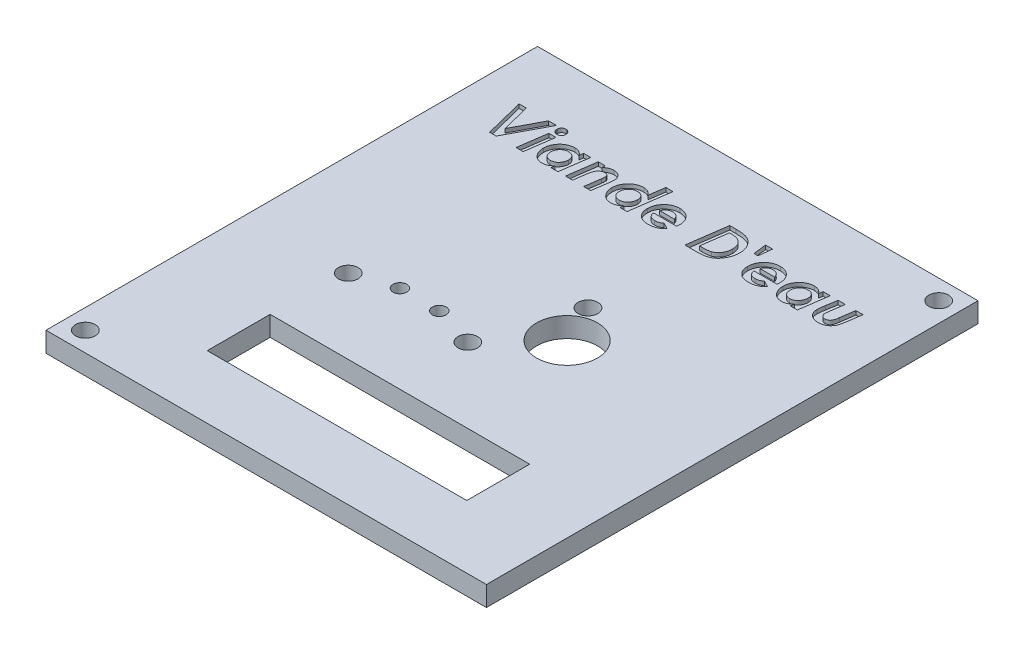
from build123d import *

# Parameters (mm, degrees)
SKETCH1_W           = 112
SKETCH1_H           = 125
BOSS_EXTRUDE1_DEPTH = 5.08
CUT_EXTRUDE1_REACH  = 86.072
SKETCH5_W           = 66
SKETCH5_H           = 16
SKETCH5_R           = 7.75
SKETCH5_R_2         = 2.5
SKETCH5_R_3         = 1.75
SKETCH7_R           = 2.5
CUT_EXTRUDE3_DEPTH  = 4
CUT_EXTRUDE4_DEPTH  = 1


with BuildPart() as part:
    # Sketch1 → Boss-Extrude1 (new body)
    with BuildSketch(Plane(origin=(0, 0, 0), x_dir=(1, 0, 0), z_dir=(0, 1, 0))):
        Rectangle(SKETCH1_W, SKETCH1_H)
    extrude(amount=BOSS_EXTRUDE1_DEPTH)

    # Sketch5 → Cut-Extrude1 (cut, up to next)
    with BuildSketch(Plane(origin=(0, 5.08, 0), x_dir=(1, 0, 0), z_dir=(0, 1, 0)), mode=Mode.PRIVATE) as cut_extrude1_sk1:
        with Locations((2, -38.5)):
            Rectangle(SKETCH5_W, SKETCH5_H)
    cut_extrude1_tool1 = extrude(cut_extrude1_sk1.sketch, amount=-CUT_EXTRUDE1_REACH, mode=Mode.PRIVATE) & part.part
    # Sketch5 → Cut-Extrude1 (cut, up to next)
    with BuildSketch(Plane(origin=(0, 5.08, 0), x_dir=(1, 0, 0), z_dir=(0, 1, 0)), mode=Mode.PRIVATE) as cut_extrude1_sk2:
        with Locations((12.5, 1.5)):
            Circle(SKETCH5_R)
    cut_extrude1_tool2 = extrude(cut_extrude1_sk2.sketch, amount=-CUT_EXTRUDE1_REACH, mode=Mode.PRIVATE) & part.part
    # Sketch5 → Cut-Extrude1 (cut, up to next)
    with BuildSketch(Plane(origin=(0, 5.08, 0), x_dir=(1, 0, 0), z_dir=(0, 1, 0)), mode=Mode.PRIVATE) as cut_extrude1_sk3:
        with Locations((-30.13, -11.51)):
            Circle(SKETCH5_R_2)
    cut_extrude1_tool3 = extrude(cut_extrude1_sk3.sketch, amount=-CUT_EXTRUDE1_REACH, mode=Mode.PRIVATE) & part.part
    # Sketch5 → Cut-Extrude1 (cut, up to next)
    with BuildSketch(Plane(origin=(0, 5.08, 0), x_dir=(1, 0, 0), z_dir=(0, 1, 0)), mode=Mode.PRIVATE) as cut_extrude1_sk4:
        with Locations((-20.25, -8.2495)):
            Circle(SKETCH5_R_3)
    cut_extrude1_tool4 = extrude(cut_extrude1_sk4.sketch, amount=-CUT_EXTRUDE1_REACH, mode=Mode.PRIVATE) & part.part
    # Sketch5 → Cut-Extrude1 (cut, up to next)
    with BuildSketch(Plane(origin=(0, 5.08, 0), x_dir=(1, 0, 0), z_dir=(0, 1, 0)), mode=Mode.PRIVATE) as cut_extrude1_sk5:
        with Locations((-10.25, -8.2495)):
            Circle(SKETCH5_R_3)
    cut_extrude1_tool5 = extrude(cut_extrude1_sk5.sketch, amount=-CUT_EXTRUDE1_REACH, mode=Mode.PRIVATE) & part.part
    # Sketch5 → Cut-Extrude1 (cut, up to next)
    with BuildSketch(Plane(origin=(0, 5.08, 0), x_dir=(1, 0, 0), z_dir=(0, 1, 0)), mode=Mode.PRIVATE) as cut_extrude1_sk6:
        with Locations((0.2695, -11.51)):
            Circle(SKETCH5_R_2)
    cut_extrude1_tool6 = extrude(cut_extrude1_sk6.sketch, amount=-CUT_EXTRUDE1_REACH, mode=Mode.PRIVATE) & part.part
    # Sketch5 → Cut-Extrude1 (cut, up to next)
    with BuildSketch(Plane(origin=(0, 5.08, 0), x_dir=(1, 0, 0), z_dir=(0, 1, 0)), mode=Mode.PRIVATE) as cut_extrude1_sk7:
        with Locations((8.001, 11.311)):
            Circle(SKETCH5_R_2)
    cut_extrude1_tool7 = extrude(cut_extrude1_sk7.sketch, amount=-CUT_EXTRUDE1_REACH, mode=Mode.PRIVATE) & part.part
    add(cut_extrude1_tool1.solids().sort_by_distance((2, 5.08, 38.5))[0], mode=Mode.SUBTRACT)
    add(cut_extrude1_tool2.solids().sort_by_distance((12.5, 5.08, -1.5))[0], mode=Mode.SUBTRACT)
    add(cut_extrude1_tool3.solids().sort_by_distance((-30.13, 5.08, 11.51))[0], mode=Mode.SUBTRACT)
    add(cut_extrude1_tool4.solids().sort_by_distance((-20.25, 5.08, 8.2495))[0], mode=Mode.SUBTRACT)
    add(cut_extrude1_tool5.solids().sort_by_distance((-10.25, 5.08, 8.2495))[0], mode=Mode.SUBTRACT)
    add(cut_extrude1_tool6.solids().sort_by_distance((0.2695, 5.08, 11.51))[0], mode=Mode.SUBTRACT)
    add(cut_extrude1_tool7.solids().sort_by_distance((8.001, 5.08, -11.311))[0], mode=Mode.SUBTRACT)

    # Sketch7 → Cut-Extrude3 (cut)
    with BuildSketch(Plane(origin=(0, 5.08, 0), x_dir=(1, 0, 0), z_dir=(0, 1, 0))):
        with Locations((-51, -57.5)):
            Circle(SKETCH7_R)
        with Locations((51, 57.5)):
            Circle(SKETCH7_R)
    extrude(amount=-CUT_EXTRUDE3_DEPTH, mode=Mode.SUBTRACT)

    # Sketch8 → Cut-Extrude4 (cut)
    # profile 1 of 12: a face of its own
    with BuildSketch(Plane(origin=(0, 5.08, 0), x_dir=(1, 0, 0), z_dir=(0, 1, 0))):
        Polygon((-45.701121795, 47.5), (-43.854166667, 47.5), (-42.051282051, 40.280448718), (-38.219150641, 47.5), (-36.203926282, 47.5), (-41.514423077, 37.5), (-43.203125, 37.5), align=None)
    # profile 2 of 12: a face of its own
    with BuildSketch(Plane(origin=(0, 5.08, 0), x_dir=(1, 0, 0), z_dir=(0, 1, 0))):
        with BuildLine():
            add(Edge.make_bspline(
                [(-34.166666667, 47.884615385), (-34.090168141, 47.880154588), (-33.939902581, 47.871392274), (-33.721996686, 47.808443635), (-33.525282026, 47.695851355), (-33.348226491, 47.549209407), (-33.201584542, 47.372153871), (-33.088992262, 47.175439211), (-33.026043624, 46.957533316), (-33.017281309, 46.807267757), (-33.012820513, 46.730769231)],
                knots=[0, 0, 0, 0, 1.014134371, 1.992057583, 2.975098753, 4, 5.024901247, 6.007942417, 6.985865629, 8, 8, 8, 8], degree=3))
            add(Edge.make_bspline(
                [(-33.012820513, 46.730769231), (-33.017250894, 46.65425342), (-33.025953463, 46.503953908), (-33.089503717, 46.285729419), (-33.200892841, 46.087630522), (-33.348398016, 45.910535017), (-33.524676948, 45.76327428), (-33.722610507, 45.653540087), (-33.939824205, 45.5900065), (-34.090141701, 45.58133675), (-34.166666667, 45.576923077)],
                knots=[0, 0, 0, 0, 1.013694729, 1.991193998, 2.981551723, 4.006008661, 5.030465598, 6.008806002, 6.986305271, 8, 8, 8, 8], degree=3))
            add(Edge.make_bspline(
                [(-34.166666667, 45.576923077), (-34.243208518, 45.581306562), (-34.39355918, 45.589917014), (-34.611099043, 45.654050805), (-34.810403902, 45.762583185), (-34.986731658, 45.910704239), (-35.134852712, 46.087031995), (-35.243385093, 46.286336855), (-35.307518884, 46.503876717), (-35.316129335, 46.65422738), (-35.320512821, 46.730769231)],
                knots=[0, 0, 0, 0, 1.01324697, 1.990314468, 2.975995575, 4, 5.024004425, 6.009685532, 6.98675303, 8, 8, 8, 8], degree=3))
            add(Edge.make_bspline(
                [(-35.320512821, 46.730769231), (-35.316099147, 46.807294197), (-35.307429397, 46.957611693), (-35.24389581, 47.174825391), (-35.134161618, 47.372758949), (-34.98690088, 47.549037882), (-34.809805376, 47.696543056), (-34.611706479, 47.80793218), (-34.39348199, 47.871482435), (-34.243182478, 47.880185004), (-34.166666667, 47.884615385)],
                knots=[0, 0, 0, 0, 1.013694729, 1.991193998, 2.969534402, 3.993991339, 5.018448277, 6.008806002, 6.986305271, 8, 8, 8, 8], degree=3))
        make_face()
    # profile 3 of 12: a face of its own
    with BuildSketch(Plane(origin=(0, 5.08, 0), x_dir=(1, 0, 0), z_dir=(0, 1, 0))):
        Polygon((-35.436698718, 44.807692308), (-33.625801282, 44.807692308), (-34.663461538, 37.5), (-36.474358974, 37.5), align=None)
    # profile 4 of 12: a face of its own
    with BuildSketch(Plane(origin=(0, 5.08, 0), x_dir=(1, 0, 0), z_dir=(0, 1, 0))):
        with BuildLine():
            Line((-26.590544872, 44.807692308), (-24.779647436, 44.807692308))
            Line((-24.779647436, 44.807692308), (-25.817307692, 37.5))
            Line((-25.817307692, 37.5), (-27.628205128, 37.5))
            Line((-27.628205128, 37.5), (-27.502003205, 38.393429487))
            add(Edge.make_bspline(
                [(-27.502003205, 38.393429487), (-27.596165009, 38.30380025), (-27.775714867, 38.132893192), (-28.0538057, 37.911169477), (-28.321500692, 37.730846121), (-28.585417776, 37.592540437), (-28.852806016, 37.49219743), (-29.130355838, 37.422696681), (-29.423710854, 37.379229714), (-29.624576983, 37.374314815), (-29.727564103, 37.371794872)],
                knots=[0, 0, 0, 0, 1.236324186, 2.357450916, 3.379388742, 4.30284698, 5.185433758, 6.089881904, 7.020653398, 8, 8, 8, 8], degree=3))
            add(Edge.make_bspline(
                [(-29.727564103, 37.371794872), (-29.845280738, 37.374537242), (-30.075822558, 37.37990803), (-30.41211944, 37.431881511), (-30.730039852, 37.513166924), (-31.029733509, 37.627863127), (-31.309581065, 37.777574259), (-31.572261767, 37.959060008), (-31.815400222, 38.174554488), (-32.035661884, 38.421207259), (-32.234304226, 38.68705184), (-32.407083008, 38.967971852), (-32.557110056, 39.257394635), (-32.673882925, 39.560607634), (-32.770277785, 39.871940162), (-32.834808102, 40.195544472), (-32.876434841, 40.529097145), (-32.881867435, 40.755081928), (-32.884615385, 40.869391026)],
                knots=[0, 0, 0, 0, 1.072254913, 2.099954687, 3.093402483, 4.05863531, 5.017013142, 5.979305845, 6.962352722, 7.970695896, 8.988290287, 9.983079422, 10.973839091, 11.95483031, 12.940586347, 13.940815436, 14.958409826, 16, 16, 16, 16], degree=3))
            add(Edge.make_bspline(
                [(-32.884615385, 40.869391026), (-32.883236568, 40.9575963), (-32.88049368, 41.133063612), (-32.853403031, 41.39479328), (-32.809262173, 41.652958862), (-32.748638316, 41.908417049), (-32.673071409, 42.161097798), (-32.578607589, 42.410092993), (-32.465295672, 42.654901272), (-32.337927797, 42.895815676), (-32.197340778, 43.129930558), (-32.039633622, 43.349667728), (-31.874083821, 43.559043029), (-31.69538113, 43.75395118), (-31.503975925, 43.933755895), (-31.303813837, 44.104126994), (-31.088449555, 44.256810443), (-30.865466716, 44.39978071), (-30.633570088, 44.524268592), (-30.399044252, 44.636138778), (-30.160077674, 44.727336176), (-29.919683931, 44.804535342), (-29.675767518, 44.862508288), (-29.42951941, 44.904179452), (-29.180650166, 44.931834347), (-29.013827951, 44.934541684), (-28.930288462, 44.935897436)],
                knots=[0, 0, 0, 0, 1.010861959, 2.01091412, 3.012605424, 4.011485121, 5.018863341, 6.033918867, 7.061452407, 8.109228878, 9.15680961, 10.18900835, 11.207521355, 12.215190347, 13.216881651, 14.216552911, 15.225616441, 16.240671966, 17.251099115, 18.240697123, 19.217272556, 20.180771028, 21.133199006, 22.08832996, 23.042693801, 24, 24, 24, 24], degree=3))
            add(Edge.make_bspline(
                [(-28.930288462, 44.935897436), (-28.819191581, 44.932732258), (-28.600203685, 44.926493238), (-28.279463882, 44.86800718), (-27.972201152, 44.775504956), (-27.679176072, 44.647228185), (-27.403989777, 44.4837752), (-27.154678182, 44.282434949), (-26.925608021, 44.051652657), (-26.800396424, 43.872881454), (-26.736778846, 43.782051282)],
                knots=[0, 0, 0, 0, 1.030509072, 2.031281277, 3.015697838, 4.003854478, 4.993584726, 5.977161716, 6.972235198, 8, 8, 8, 8], degree=3))
            Line((-26.736778846, 43.782051282), (-26.590544872, 44.807692308))
        make_face()
        with BuildLine():
            add(Edge.make_bspline(
                [(-29.324919872, 39.038461538), (-29.220494939, 39.041689162), (-29.016846835, 39.047983632), (-28.722629865, 39.103742438), (-28.448460591, 39.191548199), (-28.194753294, 39.317066724), (-27.960635481, 39.482149636), (-27.748124673, 39.68818553), (-27.556182532, 39.935002168), (-27.387852535, 40.215163443), (-27.247174137, 40.516474437), (-27.144101346, 40.827544421), (-27.078369053, 41.14240276), (-27.070989122, 41.354522178), (-27.067307692, 41.460336538)],
                knots=[0, 0, 0, 0, 1.017901168, 1.985097214, 2.910041334, 3.818973104, 4.735274743, 5.693545178, 6.695670165, 7.777101795, 8.875856117, 9.932619244, 10.968700869, 12, 12, 12, 12], degree=3))
            add(Edge.make_bspline(
                [(-27.067307692, 41.460336538), (-27.068991792, 41.526496479), (-27.072301419, 41.6565153), (-27.093935568, 41.846380913), (-27.131967002, 42.026240081), (-27.186535549, 42.19598169), (-27.256238672, 42.355788287), (-27.341592957, 42.506128365), (-27.44137962, 42.64594925), (-27.556076659, 42.775131514), (-27.684250922, 42.889581627), (-27.820151248, 42.994506579), (-27.970095537, 43.076898754), (-28.126815553, 43.148795928), (-28.294593943, 43.20182968), (-28.471147359, 43.243151159), (-28.658681953, 43.264153913), (-28.786683047, 43.267512596), (-28.852163462, 43.269230769)],
                knots=[0, 0, 0, 0, 1.109141645, 2.179707075, 3.198451464, 4.18615572, 5.163657463, 6.116161664, 7.079133258, 8.038519567, 9.005387219, 9.956904198, 10.909408399, 11.866440704, 12.843493655, 13.853714903, 14.902043453, 16, 16, 16, 16], degree=3))
            add(Edge.make_bspline(
                [(-28.852163462, 43.269230769), (-28.928415464, 43.267566333), (-29.078946805, 43.264280521), (-29.300150806, 43.230344404), (-29.513502676, 43.179673616), (-29.716936735, 43.103847069), (-29.912575584, 43.01038925), (-30.097377173, 42.892311546), (-30.274934462, 42.755491926), (-30.441477668, 42.598631444), (-30.593385826, 42.425069972), (-30.726337921, 42.237833532), (-30.839478702, 42.037989804), (-30.931669512, 41.825851283), (-31.001469235, 41.600508852), (-31.053989185, 41.364874349), (-31.084238345, 41.115904953), (-31.08787896, 40.946261872), (-31.08974359, 40.859375)],
                knots=[0, 0, 0, 0, 0.994897251, 1.964056203, 2.915642991, 3.853470011, 4.79324038, 5.741466074, 6.711095529, 7.716481674, 8.723680824, 9.71796663, 10.70964959, 11.717112863, 12.731868792, 13.785363818, 14.865719672, 16, 16, 16, 16], degree=3))
            add(Edge.make_bspline(
                [(-31.08974359, 40.859375), (-31.088029432, 40.792557497), (-31.084677254, 40.66189032), (-31.063597899, 40.470412262), (-31.022547959, 40.28973594), (-30.968644325, 40.118684656), (-30.90064345, 39.957093689), (-30.815946531, 39.805950891), (-30.715108919, 39.66497405), (-30.599582859, 39.535309025), (-30.470940934, 39.419876798), (-30.334614958, 39.316156782), (-30.187679412, 39.230280662), (-30.032139981, 39.159268084), (-29.867427054, 39.105306177), (-29.694124489, 39.068073327), (-29.512632706, 39.042607541), (-29.388445688, 39.039864629), (-29.324919872, 39.038461538)],
                knots=[0, 0, 0, 0, 1.124431694, 2.198919568, 3.234766021, 4.236791382, 5.213425507, 6.179206721, 7.145706547, 8.12447102, 9.094881178, 10.04988442, 11.001776355, 11.952075609, 12.922030374, 13.911569148, 14.931697721, 16, 16, 16, 16], degree=3))
        make_face(mode=Mode.SUBTRACT)
    # profile 5 of 12: a face of its own
    with BuildSketch(Plane(origin=(0, 5.08, 0), x_dir=(1, 0, 0), z_dir=(0, 1, 0))):
        with BuildLine():
            Line((-22.872596154, 44.807692308), (-21.061698718, 44.807692308))
            Line((-21.061698718, 44.807692308), (-21.17588141, 44.000400641))
            add(Edge.make_bspline(
                [(-21.17588141, 44.000400641), (-21.088807224, 44.074537439), (-20.918597248, 44.2194578), (-20.650791447, 44.409409918), (-20.382763712, 44.574477176), (-20.109020923, 44.703596167), (-19.834186255, 44.808230119), (-19.556322565, 44.881747101), (-19.275080076, 44.928365647), (-19.086717333, 44.933384208), (-18.992387821, 44.935897436)],
                knots=[0, 0, 0, 0, 1.129074261, 2.207080079, 3.239806547, 4.233987332, 5.191979582, 6.140686111, 7.068880775, 8, 8, 8, 8], degree=3))
            add(Edge.make_bspline(
                [(-18.992387821, 44.935897436), (-18.913539959, 44.933655668), (-18.758755356, 44.929254901), (-18.531843723, 44.904109201), (-18.316782141, 44.857417271), (-18.112219218, 44.79382962), (-17.920126055, 44.708116834), (-17.73590606, 44.60909327), (-17.565389279, 44.486875693), (-17.405660736, 44.350170529), (-17.262808211, 44.197957198), (-17.134731094, 44.037721439), (-17.02844261, 43.865715005), (-16.93934591, 43.684985249), (-16.871075476, 43.493375881), (-16.82328867, 43.292537314), (-16.794834635, 43.082411344), (-16.790878727, 42.939457897), (-16.788862179, 42.866586538)],
                knots=[0, 0, 0, 0, 1.118022855, 2.194767494, 3.230795032, 4.233728951, 5.225657328, 6.208555818, 7.193457995, 8.193528683, 9.184553253, 10.148487881, 11.096723343, 12.045053303, 13.000209424, 13.973718189, 14.967090947, 16, 16, 16, 16], degree=3))
            add(Edge.make_bspline(
                [(-16.788862179, 42.866586538), (-16.791023067, 42.787773613), (-16.795807547, 42.613271821), (-16.816132661, 42.32507586), (-16.856384753, 41.986184279), (-16.888092814, 41.742751195), (-16.905048077, 41.612580128)],
                knots=[0, 0, 0, 0, 0.750743129, 1.6622403, 2.749928862, 4, 4, 4, 4], degree=3))
            Line((-16.905048077, 41.612580128), (-17.483974359, 37.5))
            Line((-17.483974359, 37.5), (-19.294871795, 37.5))
            Line((-19.294871795, 37.5), (-18.727964744, 41.522435897))
            add(Edge.make_bspline(
                [(-18.727964744, 41.522435897), (-18.715599095, 41.613869479), (-18.692520649, 41.7845152), (-18.665498261, 42.022163247), (-18.651220057, 42.223393291), (-18.647505357, 42.345071267), (-18.645833333, 42.399839744)],
                knots=[0, 0, 0, 0, 1.255630561, 2.343427635, 3.254360171, 4, 4, 4, 4], degree=3))
            add(Edge.make_bspline(
                [(-18.645833333, 42.399839744), (-18.648682752, 42.465566045), (-18.654147544, 42.591619997), (-18.701905772, 42.769616513), (-18.786362845, 42.922484556), (-18.903101454, 43.048703807), (-19.049174122, 43.148277804), (-19.222557594, 43.220969183), (-19.424510843, 43.262228843), (-19.567780818, 43.266811211), (-19.643429487, 43.269230769)],
                knots=[0, 0, 0, 0, 1.048265012, 2.010427263, 2.912347805, 3.810226671, 4.72992967, 5.714049657, 6.792984344, 8, 8, 8, 8], degree=3))
            add(Edge.make_bspline(
                [(-19.643429487, 43.269230769), (-19.72116936, 43.264906136), (-19.878586244, 43.256149106), (-20.114749236, 43.198316662), (-20.347523926, 43.096783475), (-20.578182309, 42.964409875), (-20.796679458, 42.797457691), (-20.989260995, 42.594762458), (-21.15744301, 42.364437207), (-21.273846502, 42.145952565), (-21.354939254, 41.945786584), (-21.415068056, 41.763781865), (-21.471628933, 41.5513111), (-21.529925588, 41.309687721), (-21.585360257, 41.037538905), (-21.641325037, 40.736436802), (-21.695646915, 40.404525028), (-21.727928593, 40.173016903), (-21.744791667, 40.052083333)],
                knots=[0, 0, 0, 0, 0.882065441, 1.786110384, 2.740104157, 3.754965612, 4.797500545, 5.847687264, 6.91599857, 8.024311006, 8.646136181, 9.364850473, 10.197408591, 11.140054438, 12.184569392, 13.348033438, 14.614684545, 16, 16, 16, 16], degree=3))
            Line((-21.744791667, 40.052083333), (-22.099358974, 37.5))
            Line((-22.099358974, 37.5), (-23.91025641, 37.5))
            Line((-23.91025641, 37.5), (-22.872596154, 44.807692308))
        make_face()
    # profile 6 of 12: a face of its own
    with BuildSketch(Plane(origin=(0, 5.08, 0), x_dir=(1, 0, 0), z_dir=(0, 1, 0))):
        with BuildLine():
            Line((-8.625801282, 47.756410256), (-6.816907051, 47.756410256))
            Line((-6.816907051, 47.756410256), (-8.255208333, 37.5))
            Line((-8.255208333, 37.5), (-10.064102564, 37.5))
            Line((-10.064102564, 37.5), (-9.939903846, 38.377403846))
            add(Edge.make_bspline(
                [(-9.939903846, 38.377403846), (-10.037041394, 38.290089598), (-10.222695667, 38.123210119), (-10.50497816, 37.90236628), (-10.780098531, 37.726603976), (-11.049938862, 37.590837104), (-11.322513271, 37.489506877), (-11.607353203, 37.423181768), (-11.907018949, 37.379184032), (-12.112549946, 37.374293343), (-12.217548077, 37.371794872)],
                knots=[0, 0, 0, 0, 1.224191978, 2.339738612, 3.35557837, 4.279346016, 5.166550601, 6.074424882, 7.016295399, 8, 8, 8, 8], degree=3))
            add(Edge.make_bspline(
                [(-12.217548077, 37.371794872), (-12.337926604, 37.374558334), (-12.573766458, 37.379972376), (-12.917451609, 37.431598333), (-13.242495081, 37.513526622), (-13.549564589, 37.627800214), (-13.837009965, 37.777032118), (-14.106069791, 37.958276479), (-14.353226013, 38.175167353), (-14.579978549, 38.420233658), (-14.781655165, 38.687777871), (-14.96193294, 38.966604908), (-15.112361038, 39.257957418), (-15.234617037, 39.559998325), (-15.332032524, 39.871947805), (-15.399508122, 40.195282115), (-15.440378546, 40.529130036), (-15.445916636, 40.755092976), (-15.448717949, 40.869391026)],
                knots=[0, 0, 0, 0, 1.084756537, 2.125203127, 3.125436952, 4.102778343, 5.072150728, 6.038977154, 7.020481913, 8.030147435, 9.044022342, 10.037711967, 11.020545278, 11.995435886, 12.972332138, 13.96300789, 14.969635358, 16, 16, 16, 16], degree=3))
            add(Edge.make_bspline(
                [(-15.448717949, 40.869391026), (-15.447350493, 40.957598719), (-15.444630204, 41.133070845), (-15.417371358, 41.394764688), (-15.373842717, 41.653220059), (-15.310731295, 41.908507581), (-15.232610002, 42.160688995), (-15.139256257, 42.410642036), (-15.02299301, 42.654752896), (-14.894556953, 42.896626545), (-14.748691037, 43.128623473), (-14.592167426, 43.351039683), (-14.421930623, 43.559044207), (-14.239452488, 43.753358859), (-14.045943252, 43.934481187), (-13.841698359, 44.104072302), (-13.622483225, 44.2568845), (-13.39541477, 44.399738002), (-13.159168558, 44.52486899), (-12.919463385, 44.635669785), (-12.676104031, 44.727432252), (-12.431658051, 44.804532364), (-12.183757028, 44.862516159), (-11.93350818, 44.904181055), (-11.679975707, 44.931907311), (-11.509821436, 44.934562552), (-11.424278846, 44.935897436)],
                knots=[0, 0, 0, 0, 1.001967791, 1.993220895, 2.986098719, 3.977961405, 4.97869321, 5.984817669, 7.006498751, 8.048625242, 9.094941425, 10.118058263, 11.137144237, 12.14626801, 13.144667405, 14.147209555, 15.159750235, 16.178723228, 17.193620539, 18.195157345, 19.177309233, 20.146807454, 21.105618391, 22.067306845, 23.028366579, 24, 24, 24, 24], degree=3))
            add(Edge.make_bspline(
                [(-11.424278846, 44.935897436), (-11.311168059, 44.932044965), (-11.088100298, 44.92444744), (-10.761190764, 44.864178897), (-10.447679683, 44.768492535), (-10.150873625, 44.630829284), (-9.871150316, 44.458896128), (-9.615240864, 44.249336822), (-9.385690388, 44.002234352), (-9.257832654, 43.815211824), (-9.192708333, 43.719951923)],
                knots=[0, 0, 0, 0, 1.021752344, 2.015015653, 2.994318812, 3.977315891, 4.96380846, 5.954501398, 6.958125541, 8, 8, 8, 8], degree=3))
            Line((-9.192708333, 43.719951923), (-8.625801282, 47.756410256))
        make_face()
        with BuildLine():
            add(Edge.make_bspline(
                [(-11.834935897, 39.038461538), (-11.727846275, 39.041692581), (-11.518907673, 39.047996548), (-11.216759182, 39.103767765), (-10.934630911, 39.191476689), (-10.673054623, 39.316984869), (-10.430958636, 39.481240673), (-10.212286924, 39.68798175), (-10.014023669, 39.934587293), (-9.840180915, 40.215014305), (-9.692400078, 40.515430222), (-9.588443256, 40.827551692), (-9.519708216, 41.142153745), (-9.512705717, 41.354483346), (-9.509214744, 41.460336538)],
                knots=[0, 0, 0, 0, 1.029364739, 2.008355467, 2.944869541, 3.864220442, 4.788874237, 5.747766117, 6.747937481, 7.824404024, 8.916094465, 9.960164733, 10.983075963, 12, 12, 12, 12], degree=3))
            add(Edge.make_bspline(
                [(-9.509214744, 41.460336538), (-9.510732019, 41.526509124), (-9.513715639, 41.656633057), (-9.537745146, 41.846541308), (-9.578484548, 42.025914346), (-9.631884173, 42.196496723), (-9.704442823, 42.355757063), (-9.791354938, 42.506813392), (-9.89553013, 42.646009091), (-10.014098212, 42.775245054), (-10.146266677, 42.889663643), (-10.28621809, 42.994593339), (-10.440132016, 43.076888973), (-10.601386935, 43.149218754), (-10.774657657, 43.201769854), (-10.956532728, 43.242956441), (-11.149336001, 43.264258188), (-11.280671708, 43.267542938), (-11.348157051, 43.269230769)],
                knots=[0, 0, 0, 0, 1.092929283, 2.14917182, 3.155385987, 4.128652935, 5.096340581, 6.040415546, 7.002301806, 7.962478832, 8.931674171, 9.887023602, 10.844853392, 11.808066958, 12.802359889, 13.83011003, 14.885026967, 16, 16, 16, 16], degree=3))
            add(Edge.make_bspline(
                [(-11.348157051, 43.269230769), (-11.427078469, 43.267593637), (-11.582262591, 43.264374524), (-11.810113967, 43.230342353), (-12.029431944, 43.179688994), (-12.238863571, 43.103884119), (-12.440505263, 43.010502904), (-12.631229328, 42.892331861), (-12.814860199, 42.756345704), (-12.985334724, 42.597994313), (-13.143384246, 42.425841266), (-13.280393016, 42.238394754), (-13.395688474, 42.038103392), (-13.488988992, 41.825509296), (-13.5648781, 41.601316948), (-13.615079367, 41.364599561), (-13.649137462, 41.11610618), (-13.652251836, 40.946301733), (-13.653846154, 40.859375)],
                knots=[0, 0, 0, 0, 1.015017545, 1.99584108, 2.958882485, 3.907551637, 4.857154596, 5.813732046, 6.790026937, 7.79362874, 8.803576363, 9.793693459, 10.775457832, 11.771969563, 12.777519716, 13.815952619, 14.881936806, 16, 16, 16, 16], degree=3))
            add(Edge.make_bspline(
                [(-13.653846154, 40.859375), (-13.652385986, 40.792523704), (-13.649528753, 40.661710169), (-13.624870534, 40.470626313), (-13.585359893, 40.289324751), (-13.528395359, 40.118725257), (-13.459179712, 39.956347823), (-13.369526644, 39.806544323), (-13.267332764, 39.664186198), (-13.147416212, 39.535302307), (-13.014983369, 39.419744279), (-12.874535338, 39.316160869), (-12.723234158, 39.229681609), (-12.562562334, 39.159733342), (-12.393449505, 39.105239664), (-12.215480446, 39.067895923), (-12.028630803, 39.042643307), (-11.900460787, 39.039876186), (-11.834935897, 39.038461538)],
                knots=[0, 0, 0, 0, 1.107979885, 2.168077127, 3.188767881, 4.179540202, 5.146268969, 6.108932095, 7.067768028, 8.04709314, 9.01982551, 9.978661443, 10.935770145, 11.902498912, 12.87931775, 13.876010336, 14.914143953, 16, 16, 16, 16], degree=3))
        make_face(mode=Mode.SUBTRACT)
    # profile 7 of 12: a face of its own
    with BuildSketch(Plane(origin=(0, 5.08, 0), x_dir=(1, 0, 0), z_dir=(0, 1, 0))):
        with BuildLine():
            Line((-0.977564103, 39.661458333), (0.590945513, 38.856169872))
            add(Edge.make_bspline(
                [(0.590945513, 38.856169872), (0.498284259, 38.745303126), (0.312034678, 38.522460412), (-0.02278649, 38.233641197), (-0.397389088, 37.977623233), (-0.813082133, 37.76112666), (-1.262011527, 37.58576748), (-1.739029186, 37.463711892), (-2.238892319, 37.38371554), (-2.580478905, 37.375816755), (-2.754407051, 37.371794872)],
                knots=[0, 0, 0, 0, 0.914244933, 1.837636877, 2.790537697, 3.784087733, 4.800790172, 5.83726639, 6.89878507, 8, 8, 8, 8], degree=3))
            add(Edge.make_bspline(
                [(-2.754407051, 37.371794872), (-2.890098853, 37.374101173), (-3.154229053, 37.378590491), (-3.539281456, 37.424653598), (-3.903155905, 37.494791739), (-4.24400304, 37.597936229), (-4.564727145, 37.725698771), (-4.861371466, 37.886408014), (-5.135866565, 38.076823883), (-5.388237585, 38.291770269), (-5.61248958, 38.533519257), (-5.810205866, 38.793654748), (-5.975003605, 39.075489471), (-6.112509398, 39.374207028), (-6.215800107, 39.694021775), (-6.292674575, 40.030994305), (-6.336377289, 40.388148264), (-6.342843054, 40.632229725), (-6.346153846, 40.757211538)],
                knots=[0, 0, 0, 0, 1.167516698, 2.272623801, 3.333371772, 4.353538571, 5.333382306, 6.300396664, 7.250661637, 8.204535574, 9.148031545, 10.083792083, 11.011414416, 11.952824574, 12.908912643, 13.898953575, 14.92416002, 16, 16, 16, 16], degree=3))
            add(Edge.make_bspline(
                [(-6.346153846, 40.757211538), (-6.343191024, 40.900992049), (-6.33736392, 41.183771011), (-6.276473484, 41.598140728), (-6.18267746, 41.99610608), (-6.051212263, 42.377442243), (-5.877820356, 42.740444396), (-5.672237217, 43.089320878), (-5.423508761, 43.417817326), (-5.142429221, 43.726772767), (-4.835191472, 44.008224156), (-4.509426038, 44.256999616), (-4.166231431, 44.466730755), (-3.808143829, 44.639271351), (-3.433473582, 44.773270181), (-3.043083159, 44.865840688), (-2.637478087, 44.926992976), (-2.361336658, 44.932904856), (-2.221554487, 44.935897436)],
                knots=[0, 0, 0, 0, 1.05529311, 2.075487762, 3.068699193, 4.055083011, 5.031283693, 6.018666653, 7.023995929, 8.051577733, 9.082465902, 10.079966066, 11.057287041, 12.031169187, 12.994424047, 13.973330935, 14.974104677, 16, 16, 16, 16], degree=3))
            add(Edge.make_bspline(
                [(-2.221554487, 44.935897436), (-2.136725939, 44.934014712), (-1.969510387, 44.930303454), (-1.721738688, 44.911154527), (-1.481975735, 44.8737951), (-1.248511714, 44.827263925), (-1.023276864, 44.762153953), (-0.805037826, 44.683349772), (-0.591541994, 44.594637872), (-0.388074932, 44.486922354), (-0.190959945, 44.370466365), (-0.006541567, 44.23612726), (0.169910088, 44.093002696), (0.335317045, 43.936170907), (0.487137695, 43.764771273), (0.630478325, 43.581993196), (0.761935457, 43.385224477), (0.884160561, 43.178422296), (0.991156932, 42.961351747), (1.088501226, 42.741127244), (1.165571005, 42.513833281), (1.233549537, 42.28386781), (1.281454653, 42.046939481), (1.32189723, 41.80675865), (1.340305669, 41.561449835), (1.344195745, 41.396919989), (1.346153846, 41.314102564)],
                knots=[0, 0, 0, 0, 1.072343926, 2.113823519, 3.137889586, 4.13760148, 5.120645553, 6.097657508, 7.069516392, 8.039614793, 9.005002879, 9.960565349, 10.920144366, 11.87525951, 12.837543921, 13.811635494, 14.808779264, 15.826321551, 16.845367656, 17.865985152, 18.866871901, 19.876579391, 20.894541571, 21.919893521, 22.952961626, 24, 24, 24, 24], degree=3))
            add(Edge.make_bspline(
                [(1.346153846, 41.314102564), (1.345297618, 41.25933122), (1.343520653, 41.145661923), (1.331027644, 40.967815465), (1.308697902, 40.776801863), (1.288480818, 40.644972609), (1.278044872, 40.576923077)],
                knots=[0, 0, 0, 0, 0.886860648, 1.840539587, 2.885298471, 4, 4, 4, 4], degree=3))
            Line((1.278044872, 40.576923077), (-4.551282051, 40.576923077))
            add(Edge.make_bspline(
                [(-4.551282051, 40.576923077), (-4.547456948, 40.519423051), (-4.539995053, 40.407253761), (-4.514804022, 40.243794298), (-4.471968678, 40.090305405), (-4.415462085, 39.945743277), (-4.347265154, 39.808451029), (-4.265352668, 39.679051518), (-4.166188561, 39.561507159), (-4.055432211, 39.45214302), (-3.931977575, 39.354453445), (-3.796363821, 39.270424273), (-3.651001334, 39.196476624), (-3.492293079, 39.140152105), (-3.323813373, 39.093115305), (-3.143922918, 39.062181334), (-2.953231425, 39.041050786), (-2.821911004, 39.039340628), (-2.754407051, 39.038461538)],
                knots=[0, 0, 0, 0, 1.040300458, 2.029386266, 2.980027991, 3.911437883, 4.828060054, 5.744444316, 6.66911896, 7.598419554, 8.551199615, 9.504589747, 10.47513087, 11.489753162, 12.539789264, 13.630032591, 14.781741895, 16, 16, 16, 16], degree=3))
            add(Edge.make_bspline(
                [(-2.754407051, 39.038461538), (-2.672214327, 39.04059688), (-2.50935632, 39.044827881), (-2.268342375, 39.07218517), (-2.034912281, 39.123645166), (-1.808464696, 39.1916054), (-1.588123982, 39.277033367), (-1.37793505, 39.387456161), (-1.171682391, 39.512819577), (-1.042821351, 39.611490057), (-0.977564103, 39.661458333)],
                knots=[0, 0, 0, 0, 1.027214308, 2.035339218, 3.025519259, 4.010199041, 4.987959988, 5.973205312, 6.973599434, 8, 8, 8, 8], degree=3))
        make_face()
        with BuildLine():
            add(Edge.make_bspline(
                [(-0.576923077, 41.858974359), (-0.612543273, 41.969033397), (-0.681130527, 42.180953827), (-0.830742677, 42.468643499), (-1.013373561, 42.714450086), (-1.229247792, 42.916609361), (-1.474231891, 43.074050302), (-1.743657387, 43.187920517), (-2.037712197, 43.258064842), (-2.242524592, 43.265440952), (-2.34775641, 43.269230769)],
                knots=[0, 0, 0, 0, 1.131480038, 2.178682812, 3.159669316, 4.117470342, 5.058967564, 5.99670948, 6.970717055, 8, 8, 8, 8], degree=3))
            add(Edge.make_bspline(
                [(-2.34775641, 43.269230769), (-2.453032715, 43.265533614), (-2.660689391, 43.258241005), (-2.962392693, 43.183936757), (-3.249808151, 43.069481019), (-3.516719256, 42.905749129), (-3.763767521, 42.703850853), (-3.975813035, 42.457211647), (-4.16268784, 42.176543555), (-4.25395719, 41.966806343), (-4.30088141, 41.858974359)],
                knots=[0, 0, 0, 0, 0.983432494, 1.939812791, 2.890131691, 3.868528921, 4.858194814, 5.863362488, 6.901492691, 8, 8, 8, 8], degree=3))
            Line((-4.30088141, 41.858974359), (-0.576923077, 41.858974359))
        make_face(mode=Mode.SUBTRACT)
    # profile 8 of 12: a face of its own
    with BuildSketch(Plane(origin=(0, 5.08, 0), x_dir=(1, 0, 0), z_dir=(0, 1, 0))):
        with BuildLine():
            Line((7.876602564, 47.5), (9.455128205, 47.5))
            add(Edge.make_bspline(
                [(9.455128205, 47.5), (9.634106235, 47.498521799), (9.980214992, 47.495663244), (10.482133416, 47.472093743), (10.947957331, 47.430492785), (11.378539094, 47.372914164), (11.773913708, 47.299454078), (12.134232182, 47.210503172), (12.459853631, 47.105271386), (12.7516854, 46.978832546), (13.020393288, 46.836949968), (13.272209479, 46.675055098), (13.511471105, 46.495169833), (13.739791639, 46.29843238), (13.952542943, 46.080521319), (14.152718994, 45.843733544), (14.341086009, 45.58858236), (14.517008508, 45.317716603), (14.675252399, 45.031326785), (14.813490646, 44.731992587), (14.932176702, 44.422552807), (15.026050674, 44.10130879), (15.100260856, 43.770082033), (15.154207215, 43.427581317), (15.187137931, 43.074235924), (15.190570549, 42.835274193), (15.192307692, 42.714342949)],
                knots=[0, 0, 0, 0, 1.508928034, 2.917973822, 4.235011166, 5.450779055, 6.579221784, 7.623755204, 8.577985451, 9.460610614, 10.301756591, 11.137250569, 11.981705789, 12.823774396, 13.675702816, 14.546470419, 15.435981066, 16.347923198, 17.267651715, 18.192054867, 19.125737078, 20.059147693, 21.011116727, 21.985721956, 22.980635317, 24, 24, 24, 24], degree=3))
            add(Edge.make_bspline(
                [(15.192307692, 42.714342949), (15.189866894, 42.58940158), (15.185015467, 42.34106316), (15.150204371, 41.973056882), (15.093907845, 41.612503198), (15.016309022, 41.259527411), (14.914108756, 40.913988723), (14.786500597, 40.577707715), (14.641201239, 40.247320849), (14.470455719, 39.929622795), (14.286317394, 39.624583734), (14.086954549, 39.339360232), (13.877855628, 39.074260126), (13.653762838, 38.832920294), (13.418980684, 38.611901543), (13.173421984, 38.411208968), (12.91443769, 38.233626464), (12.642319118, 38.07599913), (12.349821524, 37.937825926), (12.032467086, 37.820773345), (11.689280472, 37.720169223), (11.318619071, 37.641630294), (10.922251063, 37.577514726), (10.499046078, 37.531592321), (10.049052283, 37.506452628), (9.740281313, 37.502192868), (9.581330128, 37.5)],
                knots=[0, 0, 0, 0, 1.035326767, 2.057856534, 3.060426681, 4.057975219, 5.050723532, 6.043595218, 7.036960241, 8.039530388, 9.030318104, 9.988216712, 10.921569661, 11.826132526, 12.714780289, 13.59198308, 14.451536877, 15.31430869, 16.195534129, 17.128821459, 18.114698389, 19.15667332, 20.266554844, 21.441073174, 22.682698532, 24, 24, 24, 24], degree=3))
            Line((9.581330128, 37.5), (6.474358974, 37.5))
            Line((6.474358974, 37.5), (7.876602564, 47.5))
        make_face()
        with BuildLine():
            Line((9.453125, 45.833333333), (8.51963141, 39.166666667))
            Line((8.51963141, 39.166666667), (9.166666667, 39.166666667))
            add(Edge.make_bspline(
                [(9.166666667, 39.166666667), (9.286875704, 39.167282348), (9.518009732, 39.16846616), (9.851890139, 39.181718913), (10.160103696, 39.197495911), (10.442490999, 39.226791747), (10.700083863, 39.259390071), (10.931132452, 39.301859828), (11.138294218, 39.347509074), (11.264332893, 39.390612051), (11.32411859, 39.411057692)],
                knots=[0, 0, 0, 0, 1.323091274, 2.54399687, 3.677836413, 4.719289959, 5.668358043, 6.534823038, 7.305002022, 8, 8, 8, 8], degree=3))
            add(Edge.make_bspline(
                [(11.32411859, 39.411057692), (11.400936335, 39.440914151), (11.553541864, 39.500226756), (11.768757796, 39.615601528), (11.977571477, 39.737885101), (12.170851925, 39.881719259), (12.355450447, 40.037854647), (12.523982198, 40.212962018), (12.684629045, 40.400600863), (12.831697403, 40.604385257), (12.966146615, 40.821046614), (13.080643071, 41.052279529), (13.179507951, 41.295011483), (13.258673515, 41.551248409), (13.321399223, 41.818967188), (13.36425235, 42.098962699), (13.39417064, 42.391178842), (13.396334481, 42.590732766), (13.397435897, 42.692307692)],
                knots=[0, 0, 0, 0, 0.952655881, 1.892538673, 2.821337892, 3.750040712, 4.676008024, 5.615700279, 6.558436491, 7.532008524, 8.520486916, 9.505184105, 10.513747313, 11.549809891, 12.604882282, 13.692134403, 14.825273528, 16, 16, 16, 16], degree=3))
            add(Edge.make_bspline(
                [(13.397435897, 42.692307692), (13.396284924, 42.775801395), (13.394035411, 42.938985159), (13.376359503, 43.178587198), (13.343597666, 43.407840624), (13.300718732, 43.626873578), (13.243729203, 43.835494713), (13.175819168, 44.033660422), (13.096705725, 44.222805527), (12.970090539, 44.456113581), (12.789610786, 44.728311281), (12.525967749, 45.016015665), (12.219592957, 45.26179193), (11.934020232, 45.433548645), (11.684798036, 45.551073483), (11.480119986, 45.626327246), (11.260675073, 45.690927045), (11.026083486, 45.741515418), (10.777727505, 45.784979323), (10.513909227, 45.811039448), (10.235329073, 45.830341973), (10.044108292, 45.832318405), (9.945913462, 45.833333333)],
                knots=[0, 0, 0, 0, 0.941373656, 1.839862062, 2.706559874, 3.551131217, 4.354742518, 5.142827075, 5.911946928, 6.663057697, 8.133107042, 9.582556681, 11.0440985, 12.547036792, 13.328439944, 14.147940985, 15.003216405, 15.905576335, 16.852443473, 17.844335315, 18.893032825, 20, 20, 20, 20], degree=3))
            Line((9.945913462, 45.833333333), (9.453125, 45.833333333))
        make_face(mode=Mode.SUBTRACT)
    # profile 9 of 12: a face of its own
    with BuildSketch(Plane(origin=(0, 5.08, 0), x_dir=(1, 0, 0), z_dir=(0, 1, 0))):
        Polygon((18.141025641, 44.423076923), (17.115384615, 44.423076923), (16.730769231, 47.756410256), (18.525641026, 47.756410256), align=None)
    # profile 10 of 12: a face of its own
    with BuildSketch(Plane(origin=(0, 5.08, 0), x_dir=(1, 0, 0), z_dir=(0, 1, 0))):
        with BuildLine():
            Line((24.53525641, 39.661458333), (26.103766026, 38.856169872))
            add(Edge.make_bspline(
                [(26.103766026, 38.856169872), (26.011104772, 38.745303126), (25.82485519, 38.522460412), (25.490034023, 38.233641197), (25.115431425, 37.977623233), (24.69973838, 37.76112666), (24.250808986, 37.58576748), (23.773791326, 37.463711892), (23.273928194, 37.38371554), (22.932341608, 37.375816755), (22.758413462, 37.371794872)],
                knots=[0, 0, 0, 0, 0.914244933, 1.837636877, 2.790537697, 3.784087733, 4.800790172, 5.83726639, 6.89878507, 8, 8, 8, 8], degree=3))
            add(Edge.make_bspline(
                [(22.758413462, 37.371794872), (22.62272166, 37.374101173), (22.35859146, 37.378590491), (21.973539056, 37.424653598), (21.609664607, 37.494791739), (21.268817473, 37.597936229), (20.948093368, 37.725698771), (20.651449047, 37.886408014), (20.376953948, 38.076823883), (20.124582928, 38.291770269), (19.900330933, 38.533519257), (19.702614647, 38.793654748), (19.537816908, 39.075489471), (19.400311114, 39.374207028), (19.297020406, 39.694021775), (19.220145937, 40.030994305), (19.176443224, 40.388148264), (19.169977459, 40.632229725), (19.166666667, 40.757211538)],
                knots=[0, 0, 0, 0, 1.167516698, 2.272623801, 3.333371772, 4.353538571, 5.333382306, 6.300396664, 7.250661637, 8.204535574, 9.148031545, 10.083792083, 11.011414416, 11.952824574, 12.908912643, 13.898953575, 14.92416002, 16, 16, 16, 16], degree=3))
            add(Edge.make_bspline(
                [(19.166666667, 40.757211538), (19.169629489, 40.900992049), (19.175456593, 41.183771011), (19.236347029, 41.598140728), (19.330143053, 41.99610608), (19.46160825, 42.377442243), (19.635000157, 42.740444396), (19.840583295, 43.089320878), (20.089311752, 43.417817326), (20.370391292, 43.726772767), (20.67762904, 44.008224156), (21.003394475, 44.256999616), (21.346589082, 44.466730755), (21.704676684, 44.639271351), (22.079346931, 44.773270181), (22.469737354, 44.865840688), (22.875342426, 44.926992976), (23.151483855, 44.932904856), (23.291266026, 44.935897436)],
                knots=[0, 0, 0, 0, 1.05529311, 2.075487762, 3.068699193, 4.055083011, 5.031283693, 6.018666653, 7.023995929, 8.051577733, 9.082465902, 10.079966066, 11.057287041, 12.031169187, 12.994424047, 13.973330935, 14.974104677, 16, 16, 16, 16], degree=3))
            add(Edge.make_bspline(
                [(23.291266026, 44.935897436), (23.376094574, 44.934014712), (23.543310126, 44.930303454), (23.791081825, 44.911154527), (24.030844778, 44.8737951), (24.264308799, 44.827263925), (24.489543649, 44.762153953), (24.707782687, 44.683349772), (24.921278519, 44.594637872), (25.124745581, 44.486922354), (25.321860568, 44.370466365), (25.506278946, 44.23612726), (25.682730601, 44.093002696), (25.848137558, 43.936170907), (25.999958208, 43.764771273), (26.143298837, 43.581993196), (26.27475597, 43.385224477), (26.396981074, 43.178422296), (26.503977445, 42.961351747), (26.601321738, 42.741127244), (26.678391518, 42.513833281), (26.74637005, 42.28386781), (26.794275165, 42.046939481), (26.834717742, 41.80675865), (26.853126181, 41.561449835), (26.857016258, 41.396919989), (26.858974359, 41.314102564)],
                knots=[0, 0, 0, 0, 1.072343926, 2.113823519, 3.137889586, 4.13760148, 5.120645553, 6.097657508, 7.069516392, 8.039614793, 9.005002879, 9.960565349, 10.920144366, 11.87525951, 12.837543921, 13.811635494, 14.808779264, 15.826321551, 16.845367656, 17.865985152, 18.866871901, 19.876579391, 20.894541571, 21.919893521, 22.952961626, 24, 24, 24, 24], degree=3))
            add(Edge.make_bspline(
                [(26.858974359, 41.314102564), (26.858118131, 41.25933122), (26.856341166, 41.145661923), (26.843848157, 40.967815465), (26.821518414, 40.776801863), (26.801301331, 40.644972609), (26.790865385, 40.576923077)],
                knots=[0, 0, 0, 0, 0.886860648, 1.840539587, 2.885298471, 4, 4, 4, 4], degree=3))
            Line((26.790865385, 40.576923077), (20.961538462, 40.576923077))
            add(Edge.make_bspline(
                [(20.961538462, 40.576923077), (20.965363565, 40.519423051), (20.97282546, 40.407253761), (20.99801649, 40.243794298), (21.040851835, 40.090305405), (21.097358428, 39.945743277), (21.165555359, 39.808451029), (21.247467845, 39.679051518), (21.346631952, 39.561507159), (21.457388302, 39.45214302), (21.580842938, 39.354453445), (21.716456692, 39.270424273), (21.861819179, 39.196476624), (22.020527434, 39.140152105), (22.18900714, 39.093115305), (22.368897594, 39.062181334), (22.559589088, 39.041050786), (22.690909509, 39.039340628), (22.758413462, 39.038461538)],
                knots=[0, 0, 0, 0, 1.040300458, 2.029386266, 2.980027991, 3.911437883, 4.828060054, 5.744444316, 6.66911896, 7.598419554, 8.551199615, 9.504589747, 10.47513087, 11.489753162, 12.539789264, 13.630032591, 14.781741895, 16, 16, 16, 16], degree=3))
            add(Edge.make_bspline(
                [(22.758413462, 39.038461538), (22.840606186, 39.04059688), (23.003464193, 39.044827881), (23.244478138, 39.07218517), (23.477908232, 39.123645166), (23.704355817, 39.1916054), (23.924696531, 39.277033367), (24.134885463, 39.387456161), (24.341138122, 39.512819577), (24.469999162, 39.611490057), (24.53525641, 39.661458333)],
                knots=[0, 0, 0, 0, 1.027214308, 2.035339218, 3.025519259, 4.010199041, 4.987959988, 5.973205312, 6.973599434, 8, 8, 8, 8], degree=3))
        make_face()
        with BuildLine():
            add(Edge.make_bspline(
                [(24.935897436, 41.858974359), (24.90027724, 41.969033397), (24.831689986, 42.180953827), (24.682077836, 42.468643499), (24.499446952, 42.714450086), (24.28357272, 42.916609361), (24.038588622, 43.074050302), (23.769163125, 43.187920517), (23.475108316, 43.258064842), (23.270295921, 43.265440952), (23.165064103, 43.269230769)],
                knots=[0, 0, 0, 0, 1.131480038, 2.178682812, 3.159669316, 4.117470342, 5.058967564, 5.99670948, 6.970717055, 8, 8, 8, 8], degree=3))
            add(Edge.make_bspline(
                [(23.165064103, 43.269230769), (23.059787798, 43.265533614), (22.852131122, 43.258241005), (22.55042782, 43.183936757), (22.263012361, 43.069481019), (21.996101257, 42.905749129), (21.749052992, 42.703850853), (21.537007478, 42.457211647), (21.350132673, 42.176543555), (21.258863323, 41.966806343), (21.211939103, 41.858974359)],
                knots=[0, 0, 0, 0, 0.983432494, 1.939812791, 2.890131691, 3.868528921, 4.858194814, 5.863362488, 6.901492691, 8, 8, 8, 8], degree=3))
            Line((21.211939103, 41.858974359), (24.935897436, 41.858974359))
        make_face(mode=Mode.SUBTRACT)
    # profile 11 of 12: a face of its own
    with BuildSketch(Plane(origin=(0, 5.08, 0), x_dir=(1, 0, 0), z_dir=(0, 1, 0))):
        with BuildLine():
            Line((34.306891026, 44.807692308), (36.117788462, 44.807692308))
            Line((36.117788462, 44.807692308), (35.080128205, 37.5))
            Line((35.080128205, 37.5), (33.269230769, 37.5))
            Line((33.269230769, 37.5), (33.395432692, 38.393429487))
            add(Edge.make_bspline(
                [(33.395432692, 38.393429487), (33.301270888, 38.30380025), (33.12172103, 38.132893192), (32.843630197, 37.911169477), (32.575935205, 37.730846121), (32.312018121, 37.592540437), (32.044629882, 37.49219743), (31.76708006, 37.422696681), (31.473725043, 37.379229714), (31.272858914, 37.374314815), (31.169871795, 37.371794872)],
                knots=[0, 0, 0, 0, 1.236324186, 2.357450916, 3.379388742, 4.30284698, 5.185433758, 6.089881904, 7.020653398, 8, 8, 8, 8], degree=3))
            add(Edge.make_bspline(
                [(31.169871795, 37.371794872), (31.05215516, 37.374537242), (30.821613339, 37.37990803), (30.485316458, 37.431881511), (30.167396045, 37.513166924), (29.867702388, 37.627863127), (29.587854833, 37.777574259), (29.32517413, 37.959060008), (29.082035675, 38.174554488), (28.861774014, 38.421207259), (28.663131672, 38.68705184), (28.49035289, 38.967971852), (28.340325842, 39.257394635), (28.223552972, 39.560607634), (28.127158112, 39.871940162), (28.062627796, 40.195544472), (28.021001056, 40.529097145), (28.015568463, 40.755081928), (28.012820513, 40.869391026)],
                knots=[0, 0, 0, 0, 1.072254913, 2.099954687, 3.093402483, 4.05863531, 5.017013142, 5.979305845, 6.962352722, 7.970695896, 8.988290287, 9.983079422, 10.973839091, 11.95483031, 12.940586347, 13.940815436, 14.958409826, 16, 16, 16, 16], degree=3))
            add(Edge.make_bspline(
                [(28.012820513, 40.869391026), (28.014199329, 40.9575963), (28.016942217, 41.133063612), (28.044032866, 41.39479328), (28.088173725, 41.652958862), (28.148797582, 41.908417049), (28.224364488, 42.161097798), (28.318828308, 42.410092993), (28.432140225, 42.654901272), (28.5595081, 42.895815676), (28.700095119, 43.129930558), (28.857802276, 43.349667728), (29.023352076, 43.559043029), (29.202054768, 43.75395118), (29.393459973, 43.933755895), (29.593622061, 44.104126994), (29.808986342, 44.256810443), (30.031969182, 44.39978071), (30.263865809, 44.524268592), (30.498391645, 44.636138778), (30.737358224, 44.727336176), (30.977751967, 44.804535342), (31.221668379, 44.862508288), (31.467916487, 44.904179452), (31.716785732, 44.931834347), (31.883607946, 44.934541684), (31.967147436, 44.935897436)],
                knots=[0, 0, 0, 0, 1.010861959, 2.01091412, 3.012605424, 4.011485121, 5.018863341, 6.033918867, 7.061452407, 8.109228878, 9.15680961, 10.18900835, 11.207521355, 12.215190347, 13.216881651, 14.216552911, 15.225616441, 16.240671966, 17.251099115, 18.240697123, 19.217272556, 20.180771028, 21.133199006, 22.08832996, 23.042693801, 24, 24, 24, 24], degree=3))
            add(Edge.make_bspline(
                [(31.967147436, 44.935897436), (32.078244317, 44.932732258), (32.297232213, 44.926493238), (32.617972016, 44.86800718), (32.925234745, 44.775504956), (33.218259825, 44.647228185), (33.493446121, 44.4837752), (33.742757716, 44.282434949), (33.971827876, 44.051652657), (34.097039473, 43.872881454), (34.160657051, 43.782051282)],
                knots=[0, 0, 0, 0, 1.030509072, 2.031281277, 3.015697838, 4.003854478, 4.993584726, 5.977161716, 6.972235198, 8, 8, 8, 8], degree=3))
            Line((34.160657051, 43.782051282), (34.306891026, 44.807692308))
        make_face()
        with BuildLine():
            add(Edge.make_bspline(
                [(31.572516026, 39.038461538), (31.676940958, 39.041689162), (31.880589062, 39.047983632), (32.174806032, 39.103742438), (32.448975306, 39.191548199), (32.702682604, 39.317066724), (32.936800416, 39.482149636), (33.149311224, 39.68818553), (33.341253366, 39.935002168), (33.509583362, 40.215163443), (33.65026176, 40.516474437), (33.753334552, 40.827544421), (33.819066845, 41.14240276), (33.826446776, 41.354522178), (33.830128205, 41.460336538)],
                knots=[0, 0, 0, 0, 1.017901168, 1.985097214, 2.910041334, 3.818973104, 4.735274743, 5.693545178, 6.695670165, 7.777101795, 8.875856117, 9.932619244, 10.968700869, 12, 12, 12, 12], degree=3))
            add(Edge.make_bspline(
                [(33.830128205, 41.460336538), (33.828444105, 41.526496479), (33.825134478, 41.6565153), (33.803500329, 41.846380913), (33.765468895, 42.026240081), (33.710900348, 42.19598169), (33.641197226, 42.355788287), (33.555842941, 42.506128365), (33.456056277, 42.64594925), (33.341359238, 42.775131514), (33.213184975, 42.889581627), (33.077284649, 42.994506579), (32.92734036, 43.076898754), (32.770620344, 43.148795928), (32.602841955, 43.20182968), (32.426288539, 43.243151159), (32.238753944, 43.264153913), (32.110752851, 43.267512596), (32.045272436, 43.269230769)],
                knots=[0, 0, 0, 0, 1.109141645, 2.179707075, 3.198451464, 4.18615572, 5.163657463, 6.116161664, 7.079133258, 8.038519567, 9.005387219, 9.956904198, 10.909408399, 11.866440704, 12.843493655, 13.853714903, 14.902043453, 16, 16, 16, 16], degree=3))
            add(Edge.make_bspline(
                [(32.045272436, 43.269230769), (31.969020434, 43.267566333), (31.818489092, 43.264280521), (31.597285092, 43.230344404), (31.383933221, 43.179673616), (31.180499162, 43.103847069), (30.984860314, 43.01038925), (30.800058725, 42.892311546), (30.622501436, 42.755491926), (30.455958229, 42.598631444), (30.304050071, 42.425069972), (30.171097976, 42.237833532), (30.057957195, 42.037989804), (29.965766385, 41.825851283), (29.895966662, 41.600508852), (29.843446712, 41.364874349), (29.813197553, 41.115904953), (29.809556938, 40.946261872), (29.807692308, 40.859375)],
                knots=[0, 0, 0, 0, 0.994897251, 1.964056203, 2.915642991, 3.853470011, 4.79324038, 5.741466074, 6.711095529, 7.716481674, 8.723680824, 9.71796663, 10.70964959, 11.717112863, 12.731868792, 13.785363818, 14.865719672, 16, 16, 16, 16], degree=3))
            add(Edge.make_bspline(
                [(29.807692308, 40.859375), (29.809406466, 40.792557497), (29.812758644, 40.66189032), (29.833837998, 40.470412262), (29.874887938, 40.28973594), (29.928791572, 40.118684656), (29.996792448, 39.957093689), (30.081489366, 39.805950891), (30.182326979, 39.66497405), (30.297853038, 39.535309025), (30.426494963, 39.419876798), (30.562820939, 39.316156782), (30.709756486, 39.230280662), (30.865295917, 39.159268084), (31.030008843, 39.105306177), (31.203311409, 39.068073327), (31.384803191, 39.042607541), (31.508990209, 39.039864629), (31.572516026, 39.038461538)],
                knots=[0, 0, 0, 0, 1.124431694, 2.198919568, 3.234766021, 4.236791382, 5.213425507, 6.179206721, 7.145706547, 8.12447102, 9.094881178, 10.04988442, 11.001776355, 11.952075609, 12.922030374, 13.911569148, 14.931697721, 16, 16, 16, 16], degree=3))
        make_face(mode=Mode.SUBTRACT)
    # profile 12 of 12: a face of its own
    with BuildSketch(Plane(origin=(0, 5.08, 0), x_dir=(1, 0, 0), z_dir=(0, 1, 0))):
        with BuildLine():
            Line((38.139022436, 44.807692308), (39.949919872, 44.807692308))
            Line((39.949919872, 44.807692308), (39.417067308, 41.09775641))
            add(Edge.make_bspline(
                [(39.417067308, 41.09775641), (39.404702235, 41.001646334), (39.381629035, 40.822305126), (39.354605899, 40.572635566), (39.34026755, 40.360735497), (39.33659744, 40.232385719), (39.334935897, 40.174278846)],
                knots=[0, 0, 0, 0, 1.253526504, 2.339077935, 3.248062684, 4, 4, 4, 4], degree=3))
            add(Edge.make_bspline(
                [(39.334935897, 40.174278846), (39.338160834, 40.09695883), (39.344479147, 39.945473034), (39.412699832, 39.730218794), (39.516059058, 39.531954125), (39.662650642, 39.359730123), (39.841310665, 39.215537022), (40.049989706, 39.112849729), (40.282643004, 39.048219529), (40.446272326, 39.041786602), (40.530849359, 39.038461538)],
                knots=[0, 0, 0, 0, 1.002835694, 1.964761131, 2.909147679, 3.895784594, 4.884866332, 5.875587295, 6.90192956, 8, 8, 8, 8], degree=3))
            add(Edge.make_bspline(
                [(40.530849359, 39.038461538), (40.586332213, 39.03940847), (40.694348035, 39.041251988), (40.851422516, 39.061527837), (40.998200315, 39.095725778), (41.135179806, 39.14178475), (41.262739912, 39.199773931), (41.379991046, 39.272384554), (41.486027733, 39.359447814), (41.586083845, 39.459515824), (41.674350939, 39.583526765), (41.758973632, 39.729794212), (41.833637768, 39.904821039), (41.906484732, 40.10490854), (41.968750973, 40.333822075), (42.026914228, 40.589097208), (42.078617436, 40.871203897), (42.106748693, 41.068933906), (42.121394231, 41.171875)],
                knots=[0, 0, 0, 0, 0.892108868, 1.736786517, 2.541881516, 3.312938247, 4.057891121, 4.791136306, 5.524224126, 6.261001152, 7.060198994, 7.964829526, 8.974738879, 10.116351085, 11.388184609, 12.787440625, 14.327495265, 16, 16, 16, 16], degree=3))
            Line((42.121394231, 41.171875), (42.640224359, 44.807692308))
            Line((42.640224359, 44.807692308), (44.453125, 44.807692308))
            Line((44.453125, 44.807692308), (43.894230769, 40.895432692))
            add(Edge.make_bspline(
                [(43.894230769, 40.895432692), (43.878296903, 40.789139045), (43.847238549, 40.581951045), (43.789191543, 40.281192376), (43.72242869, 39.998897275), (43.652482691, 39.73381474), (43.568650285, 39.489405287), (43.482217317, 39.261410276), (43.383119963, 39.053574923), (43.246770822, 38.801605572), (43.049802489, 38.51950298), (42.779151554, 38.218461086), (42.470970739, 37.960726989), (42.127339979, 37.747528658), (41.751486113, 37.576946639), (41.341995981, 37.458444508), (40.901450699, 37.384408284), (40.597261439, 37.376080771), (40.440705128, 37.371794872)],
                knots=[0, 0, 0, 0, 0.938282912, 1.828904783, 2.673080473, 3.47068305, 4.220973376, 4.927886656, 5.59807994, 6.229421123, 7.427669869, 8.591533972, 9.754419504, 10.92230609, 12.112044702, 13.346047806, 14.63409719, 16, 16, 16, 16], degree=3))
            add(Edge.make_bspline(
                [(40.440705128, 37.371794872), (40.329752678, 37.373958069), (40.113244777, 37.378179239), (39.797034249, 37.415308681), (39.498355132, 37.473934327), (39.217907123, 37.559517935), (38.953082667, 37.66483013), (38.707133339, 37.797515082), (38.477525945, 37.953136775), (38.268898976, 38.132889924), (38.080658803, 38.331153861), (37.915170869, 38.543926213), (37.775987404, 38.771680936), (37.66352659, 39.013955654), (37.575525381, 39.269156989), (37.510713969, 39.537935408), (37.472120872, 39.821252034), (37.468031413, 40.015237161), (37.465945513, 40.114182692)],
                knots=[0, 0, 0, 0, 1.168632583, 2.280420012, 3.349725486, 4.371307417, 5.365511249, 6.347568045, 7.309587773, 8.282530155, 9.242979364, 10.185822766, 11.117310968, 12.048958566, 12.994554036, 13.956959565, 14.957911239, 16, 16, 16, 16], degree=3))
            add(Edge.make_bspline(
                [(37.465945513, 40.114182692), (37.467101589, 40.178955552), (37.469485914, 40.31254506), (37.476735441, 40.519715991), (37.493751444, 40.740048458), (37.515915362, 40.974435818), (37.543114829, 41.222418156), (37.581084462, 41.483093479), (37.619297734, 41.757369257), (37.651695929, 41.943862282), (37.668269231, 42.039262821)],
                knots=[0, 0, 0, 0, 0.80233306, 1.654755999, 2.566827454, 3.538651181, 4.570611162, 5.655930814, 6.800891005, 8, 8, 8, 8], degree=3))
            Line((37.668269231, 42.039262821), (38.139022436, 44.807692308))
        make_face()
    extrude(amount=-CUT_EXTRUDE4_DEPTH, mode=Mode.SUBTRACT)


solid = part.part
